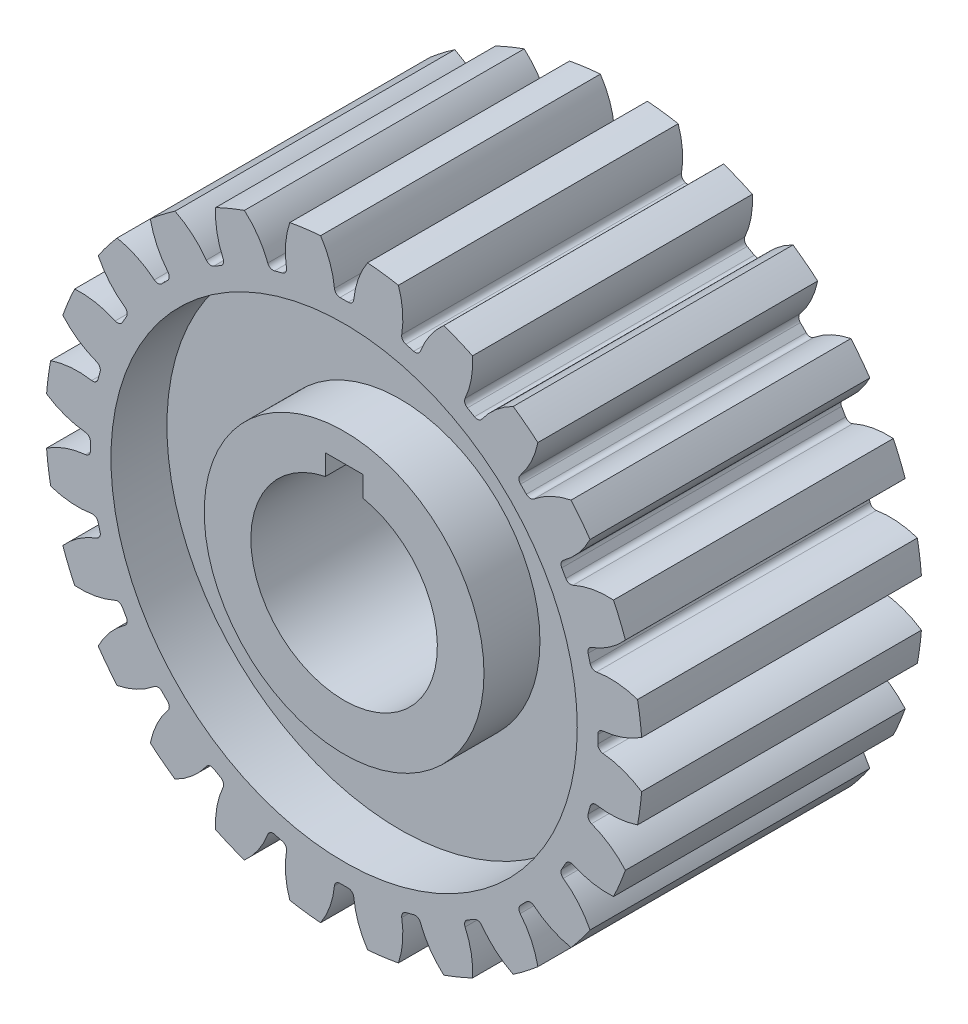
from build123d import *

# Parameters (mm, degrees)
SKETCH1_R           = 406.4
BOSS_EXTRUDE1_DEPTH = 190.5
CUT_EXTRUDE1_DEPTH  = 690.552695593
SKETCH3_R           = 317.5
SKETCH3_R_2         = 190.5
CUT_EXTRUDE2_DEPTH  = 76.2
CUT_EXTRUDE3_DEPTH  = 690.552695593
CIRPATTERN1_START   = -190.5
CIRPATTERN1_DEPTH   = 381


# Read off the part's stored shape, not the designer's step: CirPattern1
with BuildPart() as part:
    # Sketch1 → Boss-Extrude1 (new, symmetric)
    with BuildSketch(Plane.XY):
        Circle(SKETCH1_R)
    extrude(amount=BOSS_EXTRUDE1_DEPTH, both=True)

    # Sketch2 → Cut-Extrude1 (cut, through all)
    with BuildSketch(Plane.XY.offset(190.5)):
        with BuildLine():
            Line((25.4, 124.434078933), (25.4, 152.4))
            Line((25.4, 152.4), (-25.4, 152.4))
            Line((-25.4, 152.4), (-25.4, 124.434078933))
            ThreePointArc((-25.4, 124.434078933), (0, -127), (25.4, 124.434078933))
        make_face()
    extrude(amount=-CUT_EXTRUDE1_DEPTH, mode=Mode.SUBTRACT)

    # Sketch3 → Cut-Extrude2 (cut)
    with BuildSketch(Plane.XY.offset(190.5)):
        Circle(SKETCH3_R)
        Circle(SKETCH3_R_2, mode=Mode.SUBTRACT)
    cut_extrude2 = extrude(amount=-CUT_EXTRUDE2_DEPTH, mode=Mode.SUBTRACT)

    # Mirror1: Cut-Extrude2 across plane
    add(cut_extrude2.mirror(Plane.XY), mode=Mode.SUBTRACT)

    # Sketch4 → Cut-Extrude3 (cut, through all)
    with BuildSketch(Plane(origin=(0, 0, -190.5), x_dir=(-1, 0, 0), z_dir=(0, 0, -1))):
        with BuildLine():
            Line((5.584818814, 345.44), (-5.584818814, 345.44))
            ThreePointArc((-5.584818814, 345.44), (-10.70322696, 347.414975816), (-13.168424529, 352.316142246))
            ThreePointArc((-13.168424529, 352.316142246), (-25.632536768, 394.357255185), (-52.832, 428.752))
            Line((-52.832, 428.752), (52.832, 428.752))
            ThreePointArc((52.832, 428.752), (25.632536768, 394.357255185), (13.168424529, 352.316142246))
            ThreePointArc((13.168424529, 352.316142246), (10.70322696, 347.414975816), (5.584818814, 345.44))
        make_face()
    extrude(amount=-CUT_EXTRUDE3_DEPTH, mode=Mode.SUBTRACT)

    # CirPattern1 outline → CirPattern1 (cut)
    with BuildSketch(Plane.XY.offset(CIRPATTERN1_START)):
        with BuildLine():
            ThreePointArc((-84.011930213, 335.114874906), (-79.579088949, 338.347296561), (-78.466406167, 343.719499876))
            ThreePointArc((-78.466406167, 343.719499876), (-79.646115207, 371.943527977), (-73.958467208, 399.613694871))
            ThreePointArc((-73.958467208, 399.613694871), (-105.18405993, 392.552255803), (-135.756936009, 383.054845062))
            ThreePointArc((-135.756936009, 383.054845062), (-116.996204907, 361.935601605), (-103.905848854, 336.903021752))
            ThreePointArc((-103.905848854, 336.903021752), (-100.256135641, 332.806898598), (-94.800971667, 332.223959961))
            Line((-94.800971667, 332.223959961), (-84.011930213, 335.114874906))
        make_face()
        with BuildLine():
            ThreePointArc((103.905848854, 336.903021752), (116.996204907, 361.935601605), (135.756936009, 383.054845062))
            ThreePointArc((135.756936009, 383.054845062), (105.18405993, 392.552255803), (73.958467208, 399.61369487))
            ThreePointArc((73.958467208, 399.61369487), (79.646115206, 371.943527977), (78.466406167, 343.719499876))
            ThreePointArc((78.466406167, 343.719499876), (79.579088949, 338.347296561), (84.011930213, 335.114874906))
            Line((84.011930213, 335.114874906), (94.800971667, 332.223959961))
            ThreePointArc((94.800971667, 332.223959961), (100.256135641, 332.806898598), (103.905848854, 336.903021752))
        make_face()
        with BuildLine():
            ThreePointArc((187.562261293, 298.530517084), (206.685482693, 319.322099009), (230.27301981, 334.866087187))
            ThreePointArc((230.27301981, 334.866087187), (203.2, 351.952724098), (174.866028465, 366.855328554))
            ThreePointArc((174.866028465, 366.855328554), (173.198308385, 338.655928111), (164.753880953, 311.698941613))
            ThreePointArc((164.753880953, 311.698941613), (164.438221458, 306.221808192), (167.883405032, 301.95222489))
            Line((167.883405032, 301.95222489), (177.556594968, 296.367406077))
            ThreePointArc((177.556594968, 296.367406077), (182.976754358, 295.518581231), (187.562261293, 298.530517084))
        make_face()
        with BuildLine():
            ThreePointArc((258.436615585, 239.813651022), (282.289486398, 254.94732307), (309.096377854, 263.856758862))
            ThreePointArc((309.096377854, 263.856758862), (287.368195874, 287.368195874), (263.856758862, 309.096377854))
            ThreePointArc((263.856758862, 309.096377854), (254.94732307, 282.289486398), (239.813651022, 258.436615586))
            ThreePointArc((239.813651022, 258.436615586), (238.091160921, 253.22780965), (240.313903238, 248.212029748))
            Line((240.313903238, 248.212029748), (248.212029748, 240.313903238))
            ThreePointArc((248.212029748, 240.313903238), (253.227809649, 238.091160921), (258.436615585, 239.813651022))
        make_face()
        with BuildLine():
            ThreePointArc((311.698941613, 164.753880953), (338.655928111, 173.198308385), (366.855328555, 174.866028465))
            ThreePointArc((366.855328555, 174.866028465), (351.952724098, 203.2), (334.866087186, 230.27301981))
            ThreePointArc((334.866087186, 230.27301981), (319.322099009, 206.685482694), (298.530517084, 187.562261293))
            ThreePointArc((298.530517084, 187.562261293), (295.518581231, 182.976754358), (296.367406077, 177.556594968))
            Line((296.367406077, 177.556594968), (301.95222489, 167.883405032))
            ThreePointArc((301.95222489, 167.883405032), (306.221808192, 164.438221458), (311.698941613, 164.753880953))
        make_face()
        with BuildLine():
            ThreePointArc((343.719499876, 78.466406167), (371.943527977, 79.646115207), (399.613694871, 73.958467208))
            ThreePointArc((399.613694871, 73.958467208), (392.552255804, 105.18405993), (383.054845062, 135.756936009))
            ThreePointArc((383.054845062, 135.756936009), (361.935601605, 116.996204907), (336.903021752, 103.905848854))
            ThreePointArc((336.903021752, 103.905848854), (332.806898598, 100.256135641), (332.223959961, 94.800971667))
            Line((332.223959961, 94.800971667), (335.114874906, 84.011930213))
            ThreePointArc((335.114874906, 84.011930213), (338.347296561, 79.579088949), (343.719499876, 78.466406167))
        make_face()
        with BuildLine():
            ThreePointArc((352.316142246, -13.168424529), (379.883791078, -19.333829102), (405.139048274, -31.989241368))
            ThreePointArc((405.139048274, -31.989241368), (406.4, 0), (405.139048274, 31.989241368))
            ThreePointArc((405.139048274, 31.989241368), (379.883791078, 19.333829102), (352.316142246, 13.168424529))
            ThreePointArc((352.316142246, 13.168424529), (347.414975816, 10.70322696), (345.44, 5.584818814))
            Line((345.44, 5.584818814), (345.44, -5.584818814))
            ThreePointArc((345.44, -5.584818814), (347.414975816, -10.70322696), (352.316142246, -13.168424529))
        make_face()
        with BuildLine():
            ThreePointArc((336.903021752, -103.905848854), (361.935601605, -116.996204907), (383.054845062, -135.756936009))
            ThreePointArc((383.054845062, -135.756936009), (392.552255804, -105.18405993), (399.613694871, -73.958467208))
            ThreePointArc((399.613694871, -73.958467208), (371.943527977, -79.646115207), (343.719499876, -78.466406167))
            ThreePointArc((343.719499876, -78.466406167), (338.347296561, -79.579088949), (335.114874906, -84.011930213))
            Line((335.114874906, -84.011930213), (332.223959961, -94.800971667))
            ThreePointArc((332.223959961, -94.800971667), (332.806898598, -100.256135641), (336.903021752, -103.905848854))
        make_face()
        with BuildLine():
            ThreePointArc((298.530517084, -187.562261293), (319.322099009, -206.685482693), (334.866087187, -230.27301981))
            ThreePointArc((334.866087187, -230.27301981), (351.952724098, -203.2), (366.855328555, -174.866028465))
            ThreePointArc((366.855328555, -174.866028465), (338.655928111, -173.198308385), (311.698941613, -164.753880953))
            ThreePointArc((311.698941613, -164.753880953), (306.221808192, -164.438221458), (301.95222489, -167.883405032))
            Line((301.95222489, -167.883405032), (296.367406077, -177.556594968))
            ThreePointArc((296.367406077, -177.556594968), (295.518581231, -182.976754358), (298.530517084, -187.562261293))
        make_face()
        with BuildLine():
            ThreePointArc((239.813651022, -258.436615585), (254.94732307, -282.289486398), (263.856758862, -309.096377854))
            ThreePointArc((263.856758862, -309.096377854), (287.368195874, -287.368195874), (309.096377854, -263.856758862))
            ThreePointArc((309.096377854, -263.856758862), (282.289486398, -254.94732307), (258.436615586, -239.813651022))
            ThreePointArc((258.436615586, -239.813651022), (253.22780965, -238.091160921), (248.212029748, -240.313903238))
            Line((248.212029748, -240.313903238), (240.313903238, -248.212029748))
            ThreePointArc((240.313903238, -248.212029748), (238.091160921, -253.227809649), (239.813651022, -258.436615585))
        make_face()
        with BuildLine():
            ThreePointArc((164.753880953, -311.698941613), (173.198308385, -338.655928111), (174.866028465, -366.855328555))
            ThreePointArc((174.866028465, -366.855328555), (203.2, -351.952724098), (230.27301981, -334.866087187))
            ThreePointArc((230.27301981, -334.866087187), (206.685482694, -319.322099009), (187.562261293, -298.530517084))
            ThreePointArc((187.562261293, -298.530517084), (182.976754358, -295.518581231), (177.556594968, -296.367406077))
            Line((177.556594968, -296.367406077), (167.883405032, -301.95222489))
            ThreePointArc((167.883405032, -301.95222489), (164.438221458, -306.221808192), (164.753880953, -311.698941613))
        make_face()
        with BuildLine():
            ThreePointArc((78.466406167, -343.719499876), (79.646115207, -371.943527977), (73.958467208, -399.613694871))
            ThreePointArc((73.958467208, -399.613694871), (105.18405993, -392.552255804), (135.756936009, -383.054845062))
            ThreePointArc((135.756936009, -383.054845062), (116.996204907, -361.935601605), (103.905848854, -336.903021752))
            ThreePointArc((103.905848854, -336.903021752), (100.256135641, -332.806898598), (94.800971667, -332.223959961))
            Line((94.800971667, -332.223959961), (84.011930213, -335.114874906))
            ThreePointArc((84.011930213, -335.114874906), (79.579088949, -338.347296561), (78.466406167, -343.719499876))
        make_face()
        with BuildLine():
            ThreePointArc((-13.168424529, -352.316142246), (-19.333829102, -379.883791078), (-31.989241368, -405.139048274))
            ThreePointArc((-31.989241368, -405.139048274), (0, -406.4), (31.989241368, -405.139048274))
            ThreePointArc((31.989241368, -405.139048274), (19.333829102, -379.883791078), (13.168424529, -352.316142246))
            ThreePointArc((13.168424529, -352.316142246), (10.70322696, -347.414975816), (5.584818814, -345.44))
            Line((5.584818814, -345.44), (-5.584818814, -345.44))
            ThreePointArc((-5.584818814, -345.44), (-10.70322696, -347.414975816), (-13.168424529, -352.316142246))
        make_face()
        with BuildLine():
            ThreePointArc((-103.905848854, -336.903021752), (-116.996204907, -361.935601605), (-135.756936009, -383.054845062))
            ThreePointArc((-135.756936009, -383.054845062), (-105.18405993, -392.552255804), (-73.958467208, -399.613694871))
            ThreePointArc((-73.958467208, -399.613694871), (-79.646115207, -371.943527977), (-78.466406167, -343.719499876))
            ThreePointArc((-78.466406167, -343.719499876), (-79.579088949, -338.347296561), (-84.011930213, -335.114874906))
            Line((-84.011930213, -335.114874906), (-94.800971667, -332.223959961))
            ThreePointArc((-94.800971667, -332.223959961), (-100.256135641, -332.806898598), (-103.905848854, -336.903021752))
        make_face()
        with BuildLine():
            ThreePointArc((-187.562261293, -298.530517084), (-206.685482693, -319.322099009), (-230.27301981, -334.866087187))
            ThreePointArc((-230.27301981, -334.866087187), (-203.2, -351.952724098), (-174.866028465, -366.855328555))
            ThreePointArc((-174.866028465, -366.855328555), (-173.198308385, -338.655928111), (-164.753880953, -311.698941613))
            ThreePointArc((-164.753880953, -311.698941613), (-164.438221458, -306.221808192), (-167.883405032, -301.95222489))
            Line((-167.883405032, -301.95222489), (-177.556594968, -296.367406077))
            ThreePointArc((-177.556594968, -296.367406077), (-182.976754358, -295.518581231), (-187.562261293, -298.530517084))
        make_face()
        with BuildLine():
            ThreePointArc((-258.436615585, -239.813651022), (-282.289486398, -254.94732307), (-309.096377854, -263.856758862))
            ThreePointArc((-309.096377854, -263.856758862), (-287.368195874, -287.368195874), (-263.856758862, -309.096377854))
            ThreePointArc((-263.856758862, -309.096377854), (-254.94732307, -282.289486398), (-239.813651022, -258.436615586))
            ThreePointArc((-239.813651022, -258.436615586), (-238.091160921, -253.22780965), (-240.313903238, -248.212029748))
            Line((-240.313903238, -248.212029748), (-248.212029748, -240.313903238))
            ThreePointArc((-248.212029748, -240.313903238), (-253.227809649, -238.091160921), (-258.436615585, -239.813651022))
        make_face()
        with BuildLine():
            ThreePointArc((-311.698941613, -164.753880953), (-338.655928111, -173.198308385), (-366.855328555, -174.866028465))
            ThreePointArc((-366.855328555, -174.866028465), (-351.952724098, -203.2), (-334.866087187, -230.27301981))
            ThreePointArc((-334.866087187, -230.27301981), (-319.322099009, -206.685482694), (-298.530517084, -187.562261293))
            ThreePointArc((-298.530517084, -187.562261293), (-295.518581231, -182.976754358), (-296.367406077, -177.556594968))
            Line((-296.367406077, -177.556594968), (-301.95222489, -167.883405032))
            ThreePointArc((-301.95222489, -167.883405032), (-306.221808192, -164.438221458), (-311.698941613, -164.753880953))
        make_face()
        with BuildLine():
            ThreePointArc((-343.719499876, -78.466406167), (-371.943527977, -79.646115207), (-399.613694871, -73.958467208))
            ThreePointArc((-399.613694871, -73.958467208), (-392.552255804, -105.18405993), (-383.054845062, -135.756936009))
            ThreePointArc((-383.054845062, -135.756936009), (-361.935601605, -116.996204907), (-336.903021752, -103.905848854))
            ThreePointArc((-336.903021752, -103.905848854), (-332.806898598, -100.256135641), (-332.223959961, -94.800971667))
            Line((-332.223959961, -94.800971667), (-335.114874906, -84.011930213))
            ThreePointArc((-335.114874906, -84.011930213), (-338.347296561, -79.579088949), (-343.719499876, -78.466406167))
        make_face()
        with BuildLine():
            ThreePointArc((-352.316142246, 13.168424529), (-379.883791078, 19.333829102), (-405.139048274, 31.989241368))
            ThreePointArc((-405.139048274, 31.989241368), (-406.4, 0), (-405.139048274, -31.989241368))
            ThreePointArc((-405.139048274, -31.989241368), (-379.883791078, -19.333829102), (-352.316142246, -13.168424529))
            ThreePointArc((-352.316142246, -13.168424529), (-347.414975816, -10.70322696), (-345.44, -5.584818814))
            Line((-345.44, -5.584818814), (-345.44, 5.584818814))
            ThreePointArc((-345.44, 5.584818814), (-347.414975816, 10.70322696), (-352.316142246, 13.168424529))
        make_face()
        with BuildLine():
            ThreePointArc((-336.903021752, 103.905848854), (-361.935601605, 116.996204907), (-383.054845062, 135.756936009))
            ThreePointArc((-383.054845062, 135.756936009), (-392.552255804, 105.18405993), (-399.613694871, 73.958467208))
            ThreePointArc((-399.613694871, 73.958467208), (-371.943527977, 79.646115207), (-343.719499876, 78.466406167))
            ThreePointArc((-343.719499876, 78.466406167), (-338.347296561, 79.579088949), (-335.114874906, 84.011930213))
            Line((-335.114874906, 84.011930213), (-332.223959961, 94.800971667))
            ThreePointArc((-332.223959961, 94.800971667), (-332.806898598, 100.256135641), (-336.903021752, 103.905848854))
        make_face()
        with BuildLine():
            ThreePointArc((-298.530517084, 187.562261293), (-319.322099009, 206.685482693), (-334.866087187, 230.27301981))
            ThreePointArc((-334.866087187, 230.27301981), (-351.952724098, 203.2), (-366.855328554, 174.866028465))
            ThreePointArc((-366.855328554, 174.866028465), (-338.655928111, 173.198308385), (-311.698941613, 164.753880953))
            ThreePointArc((-311.698941613, 164.753880953), (-306.221808192, 164.438221458), (-301.95222489, 167.883405032))
            Line((-301.95222489, 167.883405032), (-296.367406077, 177.556594968))
            ThreePointArc((-296.367406077, 177.556594968), (-295.518581231, 182.976754358), (-298.530517084, 187.562261293))
        make_face()
        with BuildLine():
            ThreePointArc((-239.813651022, 258.436615585), (-254.94732307, 282.289486398), (-263.856758862, 309.096377854))
            ThreePointArc((-263.856758862, 309.096377854), (-287.368195874, 287.368195874), (-309.096377854, 263.856758862))
            ThreePointArc((-309.096377854, 263.856758862), (-282.289486398, 254.94732307), (-258.436615585, 239.813651022))
            ThreePointArc((-258.436615585, 239.813651022), (-253.227809649, 238.091160921), (-248.212029748, 240.313903238))
            Line((-248.212029748, 240.313903238), (-240.313903238, 248.212029748))
            ThreePointArc((-240.313903238, 248.212029748), (-238.091160921, 253.227809649), (-239.813651022, 258.436615585))
        make_face()
        with BuildLine():
            ThreePointArc((-164.753880953, 311.698941613), (-173.198308385, 338.655928111), (-174.866028465, 366.855328555))
            ThreePointArc((-174.866028465, 366.855328555), (-203.2, 351.952724098), (-230.27301981, 334.866087186))
            ThreePointArc((-230.27301981, 334.866087186), (-206.685482693, 319.322099009), (-187.562261293, 298.530517084))
            ThreePointArc((-187.562261293, 298.530517084), (-182.976754358, 295.518581231), (-177.556594968, 296.367406077))
            Line((-177.556594968, 296.367406077), (-167.883405032, 301.95222489))
            ThreePointArc((-167.883405032, 301.95222489), (-164.438221458, 306.221808192), (-164.753880953, 311.698941613))
        make_face()
    extrude(amount=CIRPATTERN1_DEPTH, mode=Mode.SUBTRACT)


solid = part.part
